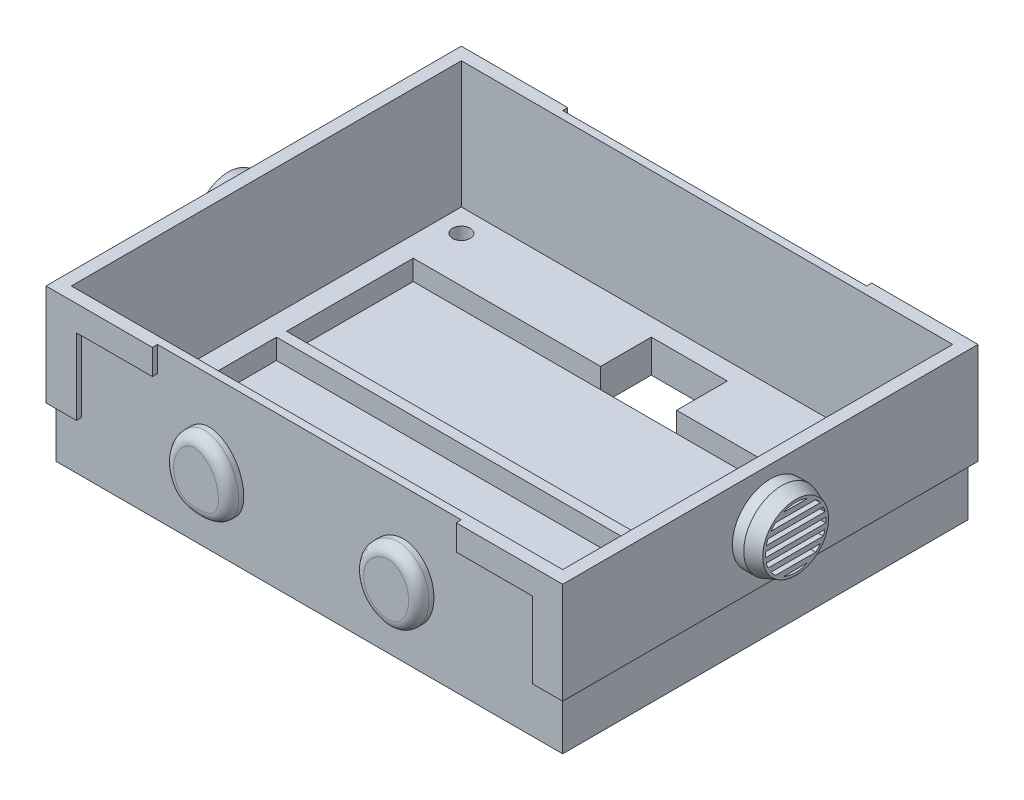
from build123d import *
from OCP.BRepFilletAPI import BRepFilletAPI_MakeChamfer

# Parameters (mm, degrees)
ESQUISSE1_W             = 100
ESQUISSE1_H             = 80
ESQUISSE1_W_2           = 15
ESQUISSE1_H_2           = 10
BOSS_EXTRU_2_DEPTH      = 5
BOSS_EXTRU_3_DEPTH      = 25
ESQUISSE9_W             = 15
ESQUISSE9_H             = 10
BOSS_EXTRU_5_DEPTH      = 1.5
ENL_V_MAT_EXTRU_4_DEPTH = 4
ESQUISSE12_R            = 1.75
ENL_V_MAT_EXTRU_5_DEPTH = 10
CONG_1_R                = 10
BOSS_EXTRU_6_DEPTH      = 1
BOSS_EXTRU_7_DEPTH      = 1
ESQUISSE15_W            = 82
ESQUISSE15_H            = 20
BOSS_EXTRU_8_DEPTH      = 1
ESQUISSE16_W            = 82
ESQUISSE16_H            = 20
BOSS_EXTRU_9_DEPTH      = 1
BOSS_EXTRU_10_DEPTH     = 3
CONG_2_R                = 2
ESQUISSE18_R            = 7.5
BOSS_EXTRU_11_DEPTH     = 5
ENL_V_MAT_EXTRU_6_DEPTH = 1
BOSS_EXTRU_12_START     = 5
ESQUISSE20_R            = 7.5
BOSS_EXTRU_12_DEPTH     = 5
ENL_V_START             = -1
ENL_V_MAT_EXTRU_7_DEPTH = 1
CHANFREIN1_SIZE         = 1
CHANFREIN1_SIZE2        = 2.747477419


with BuildPart() as part:
    # Esquisse1 → Boss.-Extru.2 (new body)
    with BuildSketch(Plane(origin=(0, 0, 0), x_dir=(1, 0, 0), z_dir=(0, 1, 0))):
        with Locations((50, 40)):
            Rectangle(ESQUISSE1_W, ESQUISSE1_H)
        with Locations((50, 70)):
            Rectangle(ESQUISSE1_W_2, ESQUISSE1_H_2, mode=Mode.SUBTRACT)
    extrude(amount=BOSS_EXTRU_2_DEPTH)

    # Esquisse2 → Boss.-Extru.3 (add)
    with BuildSketch(Plane(origin=(0, 5, 0), x_dir=(1, 0, 0), z_dir=(0, 1, 0))):
        Polygon((0, 80), (100, 80), (100, 0), (0, 0), (0, 13), (0, 68.5), align=None)
        Polygon((1.5, 10.5), (1.5, 1.5), (98.5, 1.5), (98.5, 78.5), (1.5, 78.5), (1.5, 69.5), align=None, mode=Mode.SUBTRACT)
    extrude(amount=BOSS_EXTRU_3_DEPTH)

    # Esquisse9 → Boss.-Extru.5 (add)
    with BuildSketch(Plane.XZ):
        Polygon((89, -2), (11, -2), (11, -11), (2, -11), (2, -69), (11, -69), (11, -78), (89, -78), (89, -69), (98, -69), (98, -11), (89, -11), align=None)
        with Locations((50, -70)):
            Rectangle(ESQUISSE9_W, ESQUISSE9_H, mode=Mode.SUBTRACT)
    extrude(amount=BOSS_EXTRU_5_DEPTH)

    # Esquisse11 → Enlèv. mat.-Extru.4 (cut)
    with BuildSketch(Plane(origin=(0, 5, 0), x_dir=(1, 0, 0), z_dir=(0, 1, 0))):
        Polygon((76.5, 65), (5.5, 65), (5.5, 40), (76.5, 40), (76.5, 60), (84.5, 60), (84.5, 65), align=None)
        Polygon((76.5, 38), (5.5, 38), (5.5, 13), (76.5, 13), (76.5, 33), (84.5, 33), (84.5, 38), align=None)
    extrude(amount=-ENL_V_MAT_EXTRU_4_DEPTH, mode=Mode.SUBTRACT)

    # Esquisse12 → Enlèv. mat.-Extru.5 (cut)
    with BuildSketch(Plane(origin=(0, 5, 0), x_dir=(1, 0, 0), z_dir=(0, 1, 0))):
        with Locations(Location((6, 74, 0), (0, 0, 270))):
            Circle(ESQUISSE12_R)
        with Locations(Location((94, 74, 0), (0, 0, 270))):
            Circle(ESQUISSE12_R)
        with Locations(Location((94, 6, 0), (0, 0, 270))):
            Circle(ESQUISSE12_R)
        with Locations(Location((6, 6, 0), (0, 0, 270))):
            Circle(ESQUISSE12_R)
    extrude(amount=-ENL_V_MAT_EXTRU_5_DEPTH, mode=Mode.SUBTRACT)

    # Congé1
    # the kernel refuses this fillet: 10 mm, written as the material it adds along each edge
    with BuildSketch(Plane(origin=(84.5, 1, -40), x_dir=(0, 1, 0), z_dir=(0, 0, -1))) as cong_1_piece_1:
        with BuildLine():
            CenterArc((10, -8), CONG_1_R, 126.869897646, 53.130102354)
            Line((0, -8), (0, 0))
            Line((0, 0), (4, 0))
        make_face()
    extrude(amount=25)
    with BuildSketch(Plane(origin=(84.5, 1, -13), x_dir=(0, 1, 0), z_dir=(0, 0, -1))) as cong_1_piece_2:
        with BuildLine():
            CenterArc((10, -8), CONG_1_R, 126.869897646, 53.130102354)
            Line((0, -8), (0, 0))
            Line((0, 0), (4, 0))
        make_face()
    extrude(amount=45)

    # Esquisse13 → Boss.-Extru.6 (add)
    with BuildSketch(Plane.XY):
        Polygon((5, 10), (0, 10), (0, 30), (2.888972433, 30), (20, 30), (20, 25), (5, 25), align=None)
        Polygon((100, 10), (95, 10), (95, 25), (80, 25), (80, 30), (96.225683865, 30), (100, 30), align=None)
    extrude(amount=BOSS_EXTRU_6_DEPTH)

    # Esquisse14 → Boss.-Extru.7 (add)
    with BuildSketch(Plane(origin=(0, 0, -80), x_dir=(-1, 0, 0), z_dir=(0, 0, -1))):
        Polygon((-100, 30), (-100, 10), (-95, 10), (-95, 25), (-80, 25), (-80, 30), align=None)
        Polygon((0, 30), (-20, 30), (-20, 25), (-5, 25), (-5, 10), (0, 10), align=None)
    extrude(amount=BOSS_EXTRU_7_DEPTH)

    # Esquisse15 → Boss.-Extru.8 (add)
    with BuildSketch(Plane.ZY):
        with Locations((-40, 20)):
            Rectangle(ESQUISSE15_W, ESQUISSE15_H)
    extrude(amount=BOSS_EXTRU_8_DEPTH)

    # Esquisse16 → Boss.-Extru.9 (add)
    with BuildSketch(Plane(origin=(100, 0, 0), x_dir=(0, 0, -1), z_dir=(1, 0, 0))):
        with Locations((40, 20)):
            Rectangle(ESQUISSE16_W, ESQUISSE16_H)
    extrude(amount=BOSS_EXTRU_9_DEPTH)

    # Esquisse17 → Boss.-Extru.10 (add)
    with BuildSketch(Plane.XY):
        with BuildLine():
            add(Edge.make_bspline(
                [(30.308029569, 6.894800643), (28.781486591, 7.006712657), (26.532181696, 7.708795723), (23.905506153, 11.565322531), (24.012375477, 17.188559298), (29.352841217, 22.238202255), (37.067984889, 18.495944113), (38.157209109, 7.899582488), (32.226621581, 6.754147218), (30.308029569, 6.894800643)],
                knots=[0, 0, 0, 0, 0.105175622, 0.163659041, 0.330820765, 0.473938237, 0.616947965, 0.867813019, 1, 1, 1, 1], degree=3))
        make_face()
        with BuildLine():
            add(Edge.make_bspline(
                [(70.041525941, 6.948459175), (67.790542115, 6.300771719), (61.813480135, 8.460611543), (60.868134395, 17.850454555), (68.56811792, 22.465583386), (75.326869064, 17.613223562), (74.776150998, 9.959874202), (71.181150756, 7.276369438), (70.041525941, 6.948459175)],
                knots=[0, 0, 0, 0, 0.172788457, 0.3724194, 0.560927297, 0.68732288, 0.912520912, 1, 1, 1, 1], degree=3))
        make_face()
    extrude(amount=BOSS_EXTRU_10_DEPTH)

    # Congé2
    cong_2_edges = [part.edges().sort_by_distance(p)[0] for p in [
        (30.968959963, 20.932313375, 3),
        (66.532088031, 20.663053349, 3),
    ]]
    fillet(cong_2_edges, radius=CONG_2_R)

    # Esquisse18 → Boss.-Extru.11 (add)
    with BuildSketch(Plane.ZY.offset(1)):
        with Locations((-40, 20)):
            Circle(ESQUISSE18_R)
    extrude(amount=BOSS_EXTRU_11_DEPTH)

    # Esquisse19 → Enlèv. mat.-Extru.6 (cut)
    with BuildSketch(Plane.ZY.offset(6)):
        with BuildLine():
            Line((-44.873397172, 23.5), (-35.126602828, 23.5))
            ThreePointArc((-35.126602828, 23.5), (-35.5508037, 24.025500252), (-36.031373033, 24.5))
            Line((-36.031373033, 24.5), (-43.968626967, 24.5))
            ThreePointArc((-43.968626967, 24.5), (-44.4491963, 24.025500252), (-44.873397172, 23.5))
        make_face()
        with BuildLine():
            Line((-45.454356057, 22.5), (-34.545643943, 22.5))
            ThreePointArc((-34.545643943, 22.5), (-34.345933089, 22.007866372), (-34.190524981, 21.5))
            Line((-34.190524981, 21.5), (-45.809475019, 21.5))
            ThreePointArc((-45.809475019, 21.5), (-45.654066911, 22.007866372), (-45.454356057, 22.5))
        make_face()
        with BuildLine():
            Line((-45.979130372, 20.5), (-34.020869628, 20.5))
            ThreePointArc((-34.020869628, 20.5), (-34, 20), (-34.020869628, 19.5))
            Line((-34.020869628, 19.5), (-45.979130372, 19.5))
            ThreePointArc((-45.979130372, 19.5), (-46, 20), (-45.979130372, 20.5))
        make_face()
        with BuildLine():
            Line((-45.809475019, 18.5), (-34.190524981, 18.5))
            ThreePointArc((-34.190524981, 18.5), (-34.345933089, 17.992133628), (-34.545643943, 17.5))
            Line((-34.545643943, 17.5), (-45.454356057, 17.5))
            ThreePointArc((-45.454356057, 17.5), (-45.654066911, 17.992133628), (-45.809475019, 18.5))
        make_face()
        with BuildLine():
            Line((-44.873397172, 16.5), (-35.126602828, 16.5))
            ThreePointArc((-35.126602828, 16.5), (-35.5508037, 15.974499748), (-36.031373033, 15.5))
            Line((-36.031373033, 15.5), (-43.968626967, 15.5))
            ThreePointArc((-43.968626967, 15.5), (-44.4491963, 15.974499748), (-44.873397172, 16.5))
        make_face()
        with BuildLine():
            Line((-42.397915762, 14.5), (-37.602084238, 14.5))
            ThreePointArc((-37.602084238, 14.5), (-40, 14), (-42.397915762, 14.5))
        make_face()
        with BuildLine():
            Line((-42.397915762, 25.5), (-37.602084238, 25.5))
            ThreePointArc((-37.602084238, 25.5), (-40, 26), (-42.397915762, 25.5))
        make_face()
    extrude(amount=-ENL_V_MAT_EXTRU_6_DEPTH, mode=Mode.SUBTRACT)

    # Esquisse20 → Boss.-Extru.12 (add)
    with BuildSketch(Plane(origin=(101, 0, 0), x_dir=(0, 0, -1), z_dir=(1, 0, 0)).offset(BOSS_EXTRU_12_START)):
        with Locations(Location((40, 20, 0), (0, 0, 180))):
            Circle(ESQUISSE20_R)
    extrude(amount=-BOSS_EXTRU_12_DEPTH)

    # Esquisse21 → Enlèv. mat.-Extru.7 (cut)
    with BuildSketch(Plane(origin=(106, 0, 0), x_dir=(0, 0, -1), z_dir=(1, 0, 0)).offset(ENL_V_START)):
        with BuildLine():
            Line((35.126602828, 23.5), (44.873397172, 23.5))
            ThreePointArc((44.873397172, 23.5), (44.4491963, 24.025500252), (43.968626967, 24.5))
            Line((43.968626967, 24.5), (36.031373033, 24.5))
            ThreePointArc((36.031373033, 24.5), (35.5508037, 24.025500252), (35.126602828, 23.5))
        make_face()
        with BuildLine():
            Line((34.545643943, 22.5), (45.454356057, 22.5))
            ThreePointArc((45.454356057, 22.5), (45.654066911, 22.007866372), (45.809475019, 21.5))
            Line((45.809475019, 21.5), (34.190524981, 21.5))
            ThreePointArc((34.190524981, 21.5), (34.345933089, 22.007866372), (34.545643943, 22.5))
        make_face()
        with BuildLine():
            Line((34.020869628, 20.5), (45.979130372, 20.5))
            ThreePointArc((45.979130372, 20.5), (46, 20), (45.979130372, 19.5))
            Line((45.979130372, 19.5), (34.020869628, 19.5))
            ThreePointArc((34.020869628, 19.5), (34, 20), (34.020869628, 20.5))
        make_face()
        with BuildLine():
            Line((34.190524981, 18.5), (45.809475019, 18.5))
            ThreePointArc((45.809475019, 18.5), (45.654066911, 17.992133628), (45.454356057, 17.5))
            Line((45.454356057, 17.5), (34.545643943, 17.5))
            ThreePointArc((34.545643943, 17.5), (34.345933089, 17.992133628), (34.190524981, 18.5))
        make_face()
        with BuildLine():
            Line((35.126602828, 16.5), (44.873397172, 16.5))
            ThreePointArc((44.873397172, 16.5), (44.4491963, 15.974499748), (43.968626967, 15.5))
            Line((43.968626967, 15.5), (36.031373033, 15.5))
            ThreePointArc((36.031373033, 15.5), (35.5508037, 15.974499748), (35.126602828, 16.5))
        make_face()
        with BuildLine():
            Line((37.602084238, 14.5), (42.397915762, 14.5))
            ThreePointArc((42.397915762, 14.5), (40, 14), (37.602084238, 14.5))
        make_face()
        with BuildLine():
            Line((37.602084238, 25.5), (42.397915762, 25.5))
            ThreePointArc((42.397915762, 25.5), (40, 26), (37.602084238, 25.5))
        make_face()
    extrude(amount=ENL_V_MAT_EXTRU_7_DEPTH, mode=Mode.SUBTRACT)

    # Chanfrein1: one chamfer whose edges measure the first distance from different faces: ONE call of the kernel's chamfer builder (chamfer() names one face for all edges)
    chanfrein1_edges_1 = [part.edges().sort_by_distance(p)[0] for p in [
        (-6, 20, -47.5),
    ]]
    chanfrein1_side_1 = [part.faces().sort_by_distance(p)[0] for p in [
        (-6, 20, -47.287867966),
    ]]
    chanfrein1_edges_2 = [part.edges().sort_by_distance(p)[0] for p in [
        (106, 20, -47.5),
    ]]
    chanfrein1_side_2 = [part.faces().sort_by_distance(p)[0] for p in [
        (106, 20, -47.287867966),
    ]]
    chanfrein1 = BRepFilletAPI_MakeChamfer(part.part.solid().wrapped)
    for e in chanfrein1_edges_1:
        chanfrein1.Add(CHANFREIN1_SIZE, CHANFREIN1_SIZE2, e.wrapped, chanfrein1_side_1[0].wrapped)  # the first distance lies on this face
    for e in chanfrein1_edges_2:
        chanfrein1.Add(CHANFREIN1_SIZE, CHANFREIN1_SIZE2, e.wrapped, chanfrein1_side_2[0].wrapped)  # the first distance lies on this face
    add(Compound.cast(chanfrein1.Shape()), mode=Mode.REPLACE)


solid = part.part
